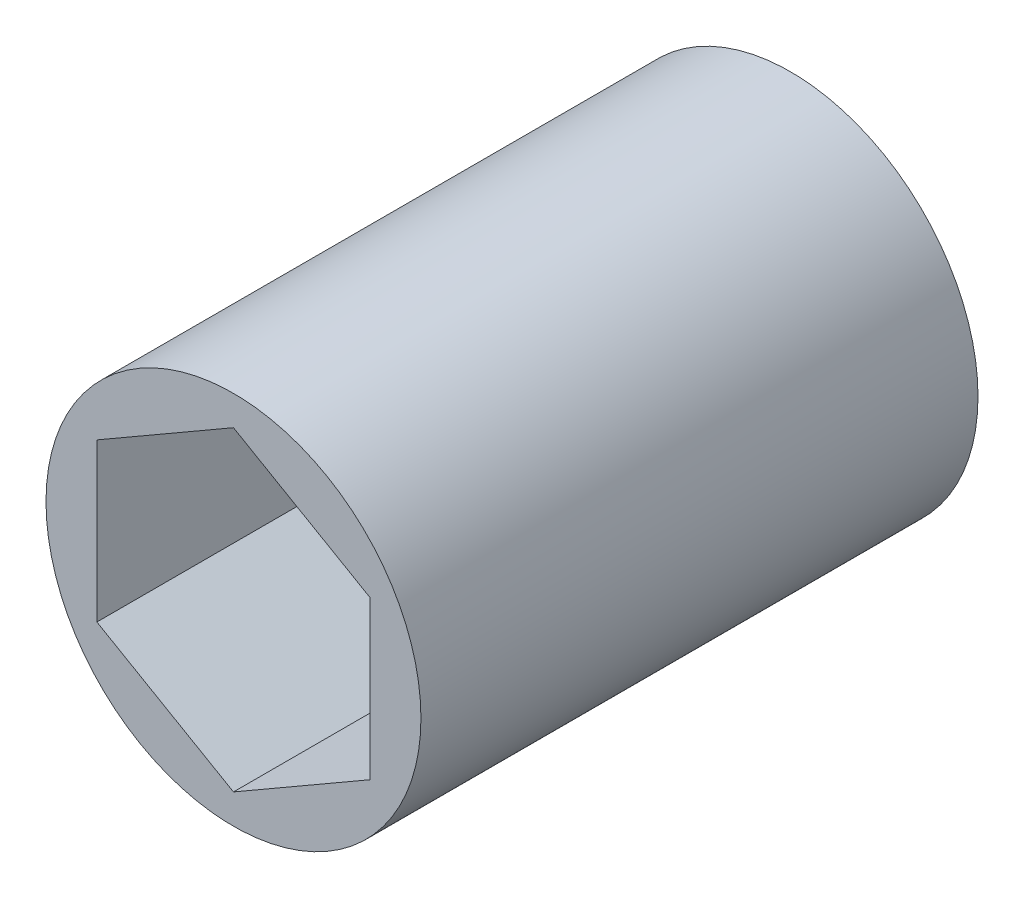
from build123d import *

# Parameters (mm, degrees)
SKETCH1_R           = 8.89
BOSS_EXTRUDE1_DEPTH = 26.416


with BuildPart() as part:
    # Sketch1 → Boss-Extrude1 (new body)
    with BuildSketch(Plane.XY):
        Circle(SKETCH1_R)
        Polygon((0, 7.478995387), (-6.477, 3.739497694), (-6.477, -3.739497694), (0, -7.478995387), (6.477, -3.739497694), (6.477, 3.739497694), align=None, mode=Mode.SUBTRACT)
    extrude(amount=BOSS_EXTRUDE1_DEPTH)


solid = part.part
